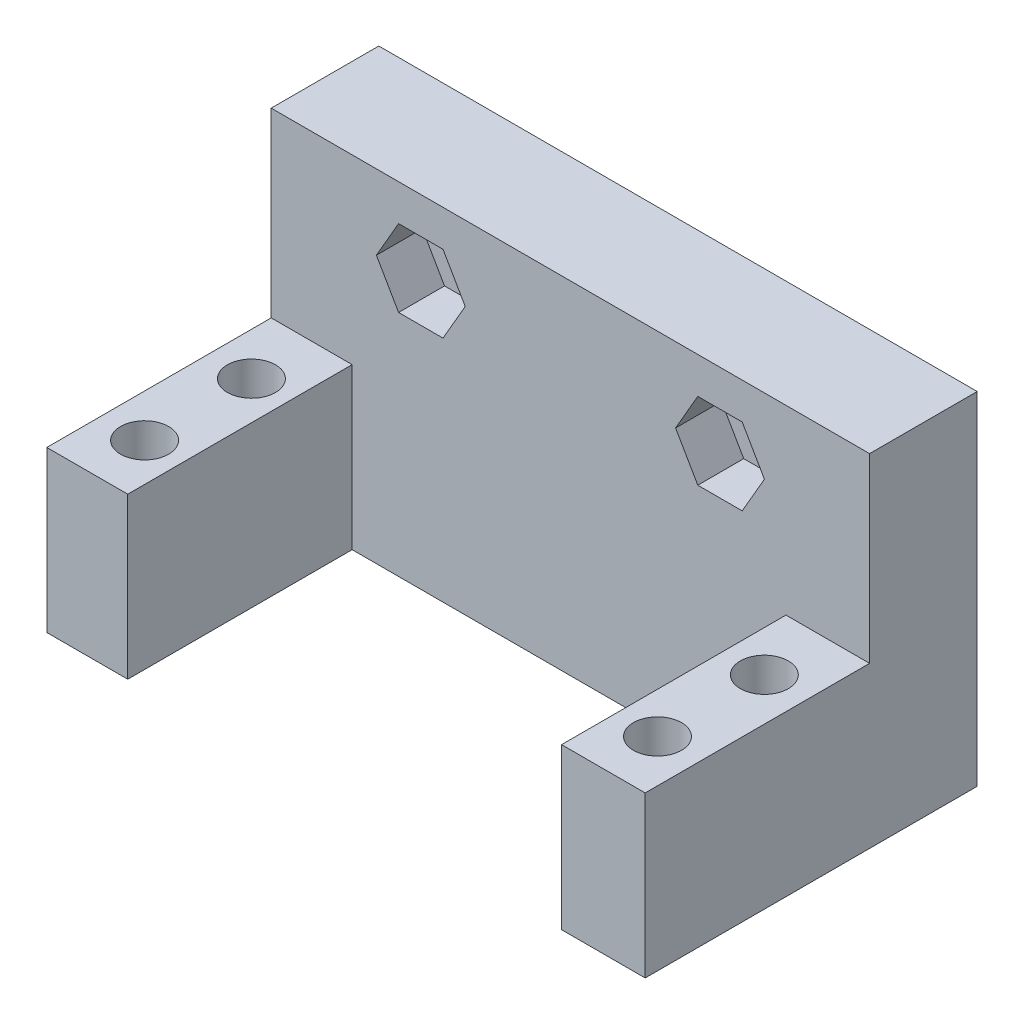
from build123d import *

# Parameters (mm, degrees)
SZKIC1_W                       = 40
SZKIC1_H                       = 14
SZKIC1_R                       = 2
DODANIE_WYCI_GNI_CIE1_DEPTH    = 10.77
SZKIC2_W                       = 56
SZKIC2_H                       = 14
DODANIE_WYCI_GNI_CIE2_DEPTH    = 20.3
SZKIC5_R                       = 2.25
WYTNIJ_WYCI_GNI_CIE2_DEPTH     = 14
SZKIC8_W                       = 56
SZKIC8_H                       = 10.77
DODANIE_WYCI_GNI_CIE3_DEPTH    = 14
WYTNIJ_WYCI_GNI_CIE3_START     = -14
WYTNIJ_WYCI_GNI_CIE3_OUTLINE_W = 42
WYTNIJ_WYCI_GNI_CIE3_OUTLINE_H = 21
WYTNIJ_WYCI_GNI_CIE3_DEPTH     = 14
SZKIC12_R                      = 2.25
DODANIE_WYCI_GNI_CIE4_DEPTH    = 18
WYTNIJ_WYCI_GNI_CIE1_DEPTH     = 5
SZKIC9_R                       = 2.2
WYTNIJ_WYCI_GNI_CIE4_DEPTH     = 21
SZKIC10_W                      = 56
SZKIC10_H                      = 21
WYTNIJ_WYCI_GNI_CIE5_DEPTH     = 17
SZKIC13_W                      = 21
SZKIC13_H                      = 15
DODANIE_WYCI_GNI_CIE5_DEPTH    = 0.7
SZKIC16_W                      = 21
SZKIC16_H                      = 15
DODANIE_WYCI_GNI_CIE7_DEPTH    = 0.7


# Read off the part's stored shape, not the designer's step: Wytnij-wyciągnięcie3
with BuildPart() as part:
    # Szkic1 → Dodanie-wyciągnięcie1 (new body)
    with BuildSketch(Plane.XY):
        Rectangle(SZKIC1_W, SZKIC1_H)
        with Locations((-14, 0)):
            Circle(SZKIC1_R, mode=Mode.SUBTRACT)
        with Locations((14, 0)):
            Circle(SZKIC1_R, mode=Mode.SUBTRACT)
    extrude(amount=DODANIE_WYCI_GNI_CIE1_DEPTH)

    # Szkic2 → Dodanie-wyciągnięcie2 (add)
    with BuildSketch(Plane.XY.offset(10.77)):
        Rectangle(SZKIC2_W, SZKIC2_H)
    extrude(amount=DODANIE_WYCI_GNI_CIE2_DEPTH)

    # Szkic5 → Wytnij-wyciągnięcie2 (cut)
    with BuildSketch(Plane(origin=(0, 7, 0), x_dir=(1, 0, 0), z_dir=(0, 1, 0))):
        with Locations(Location((-24, -15.92, 0), (0, 0, 180))):
            Circle(SZKIC5_R)
        with Locations(Location((24, -15.92, 0), (0, 0, 180))):
            Circle(SZKIC5_R)
        with Locations(Location((24, -25.92, 0), (0, 0, 180))):
            Circle(SZKIC5_R)
        with Locations(Location((-24, -25.92, 0), (0, 0, 180))):
            Circle(SZKIC5_R)
    extrude(amount=-WYTNIJ_WYCI_GNI_CIE2_DEPTH, mode=Mode.SUBTRACT)

    # Szkic8 → Dodanie-wyciągnięcie3 (add)
    with BuildSketch(Plane(origin=(0, 7, 0), x_dir=(1, 0, 0), z_dir=(0, 1, 0))):
        with Locations((0, -5.385)):
            Rectangle(SZKIC8_W, SZKIC8_H)
    extrude(amount=-DODANIE_WYCI_GNI_CIE3_DEPTH)

    # Wytnij-wyciągnięcie3 outline → Wytnij-wyciągnięcie3 (cut)
    with BuildSketch(Plane(origin=(0, 7, 0), x_dir=(1, 0, 0), z_dir=(0, 1, 0)).offset(WYTNIJ_WYCI_GNI_CIE3_START)):
        with Locations((-0.124911353, -20.57)):
            Rectangle(WYTNIJ_WYCI_GNI_CIE3_OUTLINE_W, WYTNIJ_WYCI_GNI_CIE3_OUTLINE_H)
    extrude(amount=WYTNIJ_WYCI_GNI_CIE3_DEPTH, mode=Mode.SUBTRACT)

    # Szkic12 → Dodanie-wyciągnięcie4 (add)
    with BuildSketch(Plane.XZ.offset(7)):
        Polygon((20.875088647, 31.07), (20.875088647, 10.07), (-21.124911353, 10.07), (-21.124911353, 31.07), (-28, 31.07), (-28, 0), (28, 0), (28, 31.07), align=None)
        with Locations(Location((-24, 25.92, 0), (0, 0, 180))):
            Circle(SZKIC12_R, mode=Mode.SUBTRACT)
        with Locations(Location((24, 25.92, 0), (0, 0, 180))):
            Circle(SZKIC12_R, mode=Mode.SUBTRACT)
        with Locations(Location((-24, 15.92, 0), (0, 0, 180))):
            Circle(SZKIC12_R, mode=Mode.SUBTRACT)
        with Locations(Location((24, 15.92, 0), (0, 0, 180))):
            Circle(SZKIC12_R, mode=Mode.SUBTRACT)
    extrude(amount=DODANIE_WYCI_GNI_CIE4_DEPTH)

    # Szkic4 → Wytnij-wyciągnięcie1 (cut)
    with BuildSketch(Plane.XY.offset(10.77)):
        Polygon((-16.078460969, 3.6), (-18.156921938, 0), (-16.078460969, -3.6), (-11.921539031, -3.6), (-9.843078062, 0), (-11.921539031, 3.6), align=None)
        Polygon((11.921539031, 3.6), (9.843078062, 0), (11.921539031, -3.6), (16.078460969, -3.6), (18.156921938, 0), (16.078460969, 3.6), align=None)
    extrude(amount=-WYTNIJ_WYCI_GNI_CIE1_DEPTH, mode=Mode.SUBTRACT)

    # Szkic9 → Wytnij-wyciągnięcie4 (cut)
    with BuildSketch(Plane.XY.offset(10.07)):
        with Locations((-14, 0)):
            Circle(SZKIC9_R)
        with Locations((14, 0)):
            Circle(SZKIC9_R)
    extrude(amount=-WYTNIJ_WYCI_GNI_CIE4_DEPTH, mode=Mode.SUBTRACT)

    # Szkic10 → Wytnij-wyciągnięcie5 (cut)
    with BuildSketch(Plane(origin=(0, 7, 0), x_dir=(1, 0, 0), z_dir=(0, 1, 0))):
        with Locations((0, -20.57)):
            Rectangle(SZKIC10_W, SZKIC10_H)
    extrude(amount=-WYTNIJ_WYCI_GNI_CIE5_DEPTH, mode=Mode.SUBTRACT)

    # Szkic13 → Dodanie-wyciągnięcie5 (add)
    with BuildSketch(Plane(origin=(-21.124911353, 0, 0), x_dir=(0, 0, -1), z_dir=(1, 0, 0))):
        with Locations((-20.57, -17.5)):
            Rectangle(SZKIC13_W, SZKIC13_H)
    extrude(amount=DODANIE_WYCI_GNI_CIE5_DEPTH)

    # Szkic16 → Dodanie-wyciągnięcie7 (add)
    with BuildSketch(Plane.ZY.offset(-20.875088647)):
        with Locations((20.57, -17.5)):
            Rectangle(SZKIC16_W, SZKIC16_H)
    extrude(amount=DODANIE_WYCI_GNI_CIE7_DEPTH)


solid = part.part
